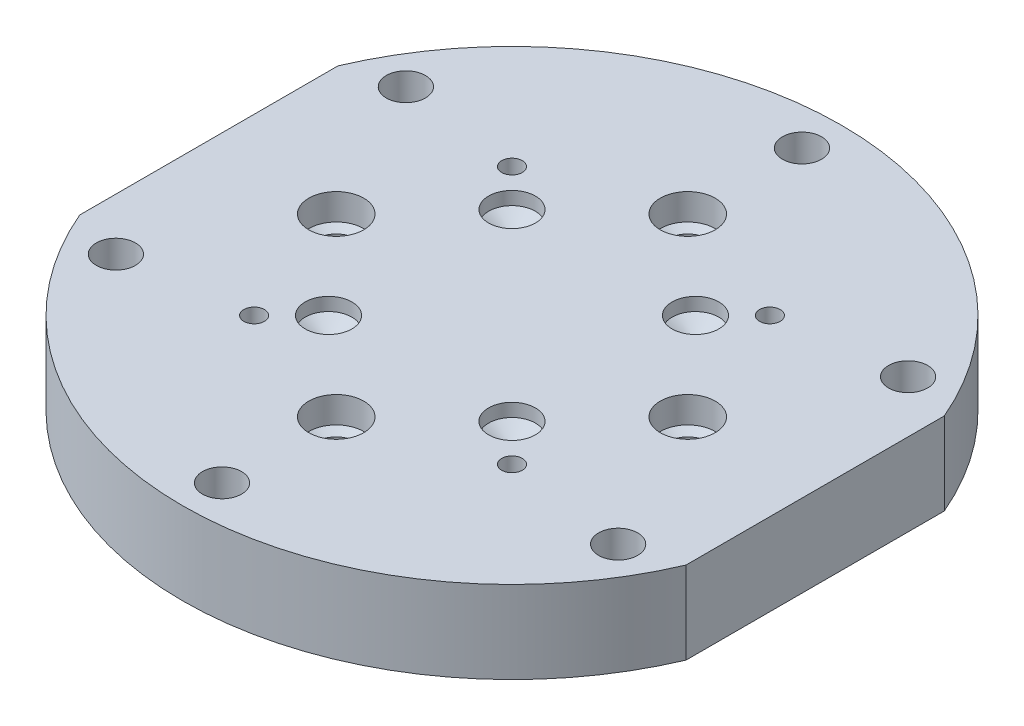
from build123d import *

# Parameters (mm, degrees)
OUTER_R                     = 19.05
BODY_DEPTH                  = 4.7625
F_4_40_TAPPED_HOLE_D        = 2.2606
SCREW_HOLES_COUNT           = 6
F_0_80_TAPPED_HOLE_D        = 1.19126
INNER_SCREW_HOLES_COUNT     = 4
F_43_0_089_DIAMETER_HOLE1_D = 2.2606
IO_HOLES_PATTERN_COUNT      = 4
POST_BOTTOMS_COUNT          = 4
CUT_EXTRUDE1_DEPTH          = 28.358479604
CUT_EXTRUDE1_DEPTH_BACK     = 28.358479604
FLAT_CUT_SKETCH_W           = 3.048
FLAT_CUT_SKETCH_H           = 38.1


with BuildPart() as part:
    # outer → Body (new body)
    with BuildSketch(Plane(origin=(0, 0, 0), x_dir=(1, 0, 0), z_dir=(0, 1, 0))):
        Circle(OUTER_R)
    extrude(amount=-BODY_DEPTH)

    # #4-40 Tapped Hole (through all)
    with Locations(Plane(origin=(0, 0, 0), x_dir=(1, 0, 0), z_dir=(0, 1, 0))):
        with Locations((0, -16.764)):
            f_4_40_tapped_hole = Hole(F_4_40_TAPPED_HOLE_D / 2)

    # Screw Holes: #4-40 Tapped Hole ×6 about axis
    screw_holes_axis = Axis((0, 0.15875, 0), (0, -1, 0))
    for i in range(1, SCREW_HOLES_COUNT):
        add(f_4_40_tapped_hole.rotate(screw_holes_axis, i * 360 / SCREW_HOLES_COUNT), mode=Mode.SUBTRACT)

    # #0-80 Tapped Hole (through all)
    with Locations(Plane(origin=(0, 0, 0), x_dir=(1, 0, 0), z_dir=(0, 1, 0))):
        with Locations((-7.45361258, 7.45361258)):
            f_0_80_tapped_hole = Hole(F_0_80_TAPPED_HOLE_D / 2)

    # Inner Screw Holes: #0-80 Tapped Hole ×4 about axis
    inner_screw_holes_axis = Axis((0, 0.15875, 0), (0, -1, 0))
    for i in range(1, INNER_SCREW_HOLES_COUNT):
        add(f_0_80_tapped_hole.rotate(inner_screw_holes_axis, i * 360 / INNER_SCREW_HOLES_COUNT), mode=Mode.SUBTRACT)

    # #43 (0.089) Diameter Hole1 (through all)
    with Locations(Plane(origin=(0, 0, 0), x_dir=(1, 0, 0), z_dir=(0, 1, 0))):
        with Locations((0, 10.16)):
            f_43_0_089_diameter_hole1 = Hole(F_43_0_089_DIAMETER_HOLE1_D / 2)

    # Sketch40 → 1/8 (0.125) Diameter Hole1 (revolve, cut)
    with BuildSketch(Plane(origin=(0, 0, -10.16), x_dir=(0, 0, 1), z_dir=(1, 0, 0))):
        Polygon((0, 0), (0, 2.477866233), (1.5875, 1.524), (1.5875, 0), align=None)
    f_1_8_0_125_diameter_hole1 = revolve(axis=Axis((0, 6.35, -10.16), (0, -1, 0)), mode=Mode.SUBTRACT)

    # Sketch42 → 1/8 (0.125) Diameter Hole2 (revolve, cut)
    with BuildSketch(Plane(origin=(0, -4.7625, -10.16), x_dir=(0, 0, -1), z_dir=(1, 0, 0))):
        Polygon((0, 0), (0, 2.477866233), (1.5875, 1.524), (1.5875, 0), align=None)
    f_1_8_0_125_diameter_hole2 = revolve(axis=Axis((0, -11.1125, -10.16), (0, 1, 0)), mode=Mode.SUBTRACT)

    # IO Holes Pattern: #43 (0.089) Diameter Hole1, 1/8 (0.125) Diameter Hole1, 1/8 (0.125) Diameter Hole2 ×4 about axis
    io_holes_pattern_axis = Axis((0, 0.15875, 0), (0, -1, 0))
    add([f_43_0_089_diameter_hole1.rotate(io_holes_pattern_axis, i * 360 / IO_HOLES_PATTERN_COUNT) for i in range(1, IO_HOLES_PATTERN_COUNT)], mode=Mode.SUBTRACT)
    add([f_1_8_0_125_diameter_hole1.rotate(io_holes_pattern_axis, i * 360 / IO_HOLES_PATTERN_COUNT) for i in range(1, IO_HOLES_PATTERN_COUNT)], mode=Mode.SUBTRACT)
    add([f_1_8_0_125_diameter_hole2.rotate(io_holes_pattern_axis, i * 360 / IO_HOLES_PATTERN_COUNT) for i in range(1, IO_HOLES_PATTERN_COUNT)], mode=Mode.SUBTRACT)

    # Sketch45 → #36 (0.1065) Diameter Hole1 (revolve, cut)
    with BuildSketch(Plane(origin=(-5.303300849, 0, -5.303300849), x_dir=(0, 0, 1), z_dir=(1, 0, 0))):
        Polygon((0, 0), (0, 1.57469403), (1.35255, 0.762), (1.35255, 0), align=None)
    f_36_0_1065_diameter_hole1 = revolve(axis=Axis((-5.303300849, 6.35, -5.303300849), (0, -1, 0)), mode=Mode.SUBTRACT)

    # Post Bottoms: #36 (0.1065) Diameter Hole1 ×4 about axis
    post_bottoms_axis = Axis((0, 0.15875, 0), (0, -1, 0))
    for i in range(1, POST_BOTTOMS_COUNT):
        add(f_36_0_1065_diameter_hole1.rotate(post_bottoms_axis, i * 360 / POST_BOTTOMS_COUNT), mode=Mode.SUBTRACT)

    # Flat Cut Sketch → Cut-Extrude1 (cut, two sides: drawn at the far end of the back side and taken through both)
    with BuildSketch(Plane(origin=(0, 0, 0), x_dir=(1, 0, 0), z_dir=(0, 1, 0)).offset(-CUT_EXTRUDE1_DEPTH_BACK)):
        with Locations((-19.05, 0)):
            Rectangle(FLAT_CUT_SKETCH_W, FLAT_CUT_SKETCH_H)
        with Locations((19.05, 0)):
            Rectangle(FLAT_CUT_SKETCH_W, FLAT_CUT_SKETCH_H)
    extrude(amount=CUT_EXTRUDE1_DEPTH + CUT_EXTRUDE1_DEPTH_BACK, mode=Mode.SUBTRACT)


solid = part.part
